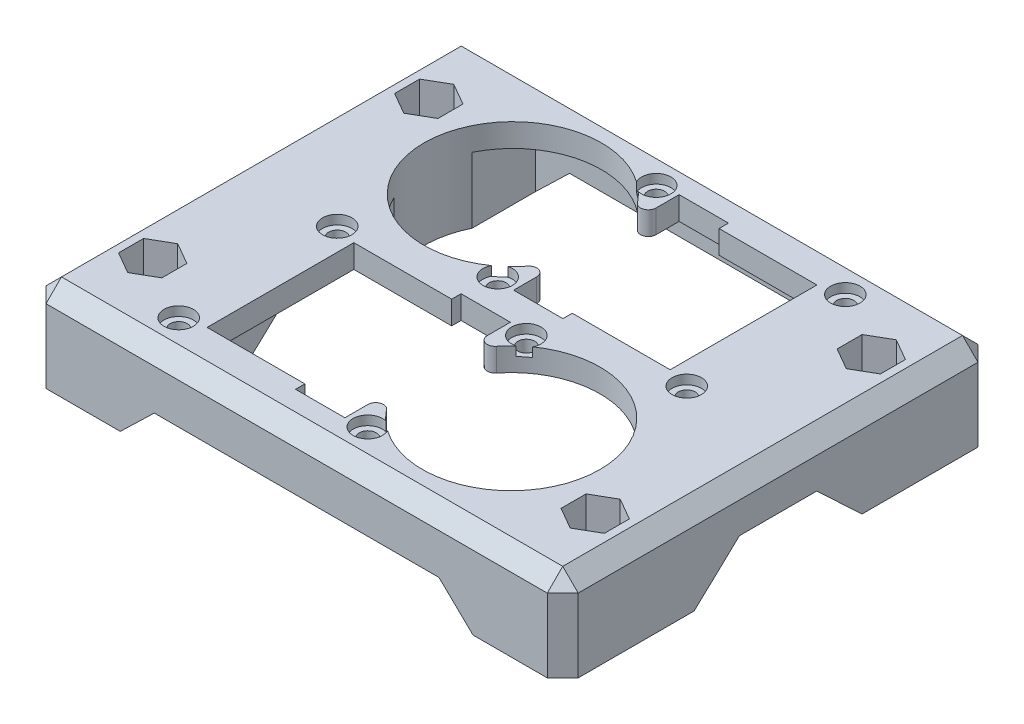
from build123d import *
from build123d.topology import SkipClean

# Parameters (mm, degrees)
ESQUISSE1_W                                        = 50.5
ESQUISSE1_H                                        = 51.7
ESQUISSE1_R                                        = 1.1
BOSS_EXTRU_1_DEPTH                                 = 3
CONG_1_R                                           = 1
CHAMBRAGE_POUR_VIS_SIX_PANS_CREUX_M1_6_D           = 2.2
CHAMBRAGE_POUR_VIS_SIX_PANS_CREUX_M1_6_CBORE_D     = 3.8
CHAMBRAGE_POUR_VIS_SIX_PANS_CREUX_M1_6_CBORE_DEPTH = 1.2
BOSS_EXTRU_2_START                                 = -19
ESQUISSE4_R                                        = 1.6
BOSS_EXTRU_2_DEPTH                                 = 19
ENL_V_START                                        = -19
ENL_V_MAT_EXTRU_1_DEPTH                            = 7
ENL_V_MAT_EXTRU_2_DEPTH                            = 77.075175977
ENL_V_MAT_EXTRU_2_DEPTH_BACK                       = 77.075175977
BOSS_EXTRU_3_DEPTH                                 = 2
CHANFREIN1_SIZE                                    = 2


with BuildPart() as part:
    # Esquisse1 → Boss.-Extru.1 (new body)
    with BuildSketch(Plane(origin=(0, 0, 0), x_dir=(1, 0, 0), z_dir=(0, 1, 0))):
        with Locations((4.2, -2.35)):
            Rectangle(ESQUISSE1_W, ESQUISSE1_H)
        with Locations(Location((-16.05, -25.2, 0), (0, 0, 270))):
            Circle(ESQUISSE1_R, mode=Mode.SUBTRACT)
        with Locations(Location((-16.05, -4.7, 0), (0, 0, 270))):
            Circle(ESQUISSE1_R, mode=Mode.SUBTRACT)
        with Locations(Location((8.4, -25.2, 0), (0, 0, 270))):
            Circle(ESQUISSE1_R, mode=Mode.SUBTRACT)
        with BuildLine():
            Line((-0.49, -5.46), (-0.49, -4.25))
            Line((-0.49, -4.25), (5.89, -4.25))
            Line((5.89, -4.25), (5.89, -11.085507795))
            ThreePointArc((5.89, -11.085507795), (18.661071136, -3.638740123), (28.18, -14.95))
            ThreePointArc((28.18, -14.95), (18.661071136, -26.261259877), (5.89, -18.814492205))
            Line((5.89, -18.814492205), (5.89, -25.65))
            Line((5.89, -25.65), (-0.49, -25.65))
            Line((-0.49, -25.65), (-0.49, -24.44))
            Line((-0.49, -24.44), (-13.14, -24.44))
            Line((-13.14, -24.44), (-13.14, -5.46))
            Line((-13.14, -5.46), (-0.49, -5.46))
        make_face(mode=Mode.SUBTRACT)
        with Locations(Location((8.4, -4.7, 0), (0, 0, 270))):
            Circle(ESQUISSE1_R, mode=Mode.SUBTRACT)
        with Locations(Location((0, 0, 0), (0, 0, 270))):
            Circle(ESQUISSE1_R, mode=Mode.SUBTRACT)
        with BuildLine():
            Line((8.89, 20.95), (8.89, 19.74))
            Line((8.89, 19.74), (21.54, 19.74))
            Line((21.54, 19.74), (21.54, 0.76))
            Line((21.54, 0.76), (8.89, 0.76))
            Line((8.89, 0.76), (8.89, -0.45))
            Line((8.89, -0.45), (2.51, -0.45))
            Line((2.51, -0.45), (2.51, 6.385507795))
            ThreePointArc((2.51, 6.385507795), (-19.78, 10.25), (2.51, 14.114492205))
            Line((2.51, 14.114492205), (2.51, 20.95))
            Line((2.51, 20.95), (8.89, 20.95))
        make_face(mode=Mode.SUBTRACT)
        with Locations(Location((0, 20.5, 0), (0, 0, 270))):
            Circle(ESQUISSE1_R, mode=Mode.SUBTRACT)
        with Locations(Location((24.45, 0, 0), (0, 0, 270))):
            Circle(ESQUISSE1_R, mode=Mode.SUBTRACT)
        with Locations(Location((24.45, 20.5, 0), (0, 0, 270))):
            Circle(ESQUISSE1_R, mode=Mode.SUBTRACT)
    extrude(amount=BOSS_EXTRU_1_DEPTH)

    # Congé1
    cong_1_edges = [part.edges().sort_by_distance(p)[0] for p in [
        (2.51, 1.5, -6.385507795),
        (2.51, 1.5, -14.114492205),
        (5.89, 1.5, 11.085507795),
        (5.89, 1.5, 18.814492205),
    ]]
    fillet(cong_1_edges, radius=CONG_1_R)

    # Chambrage pour vis à six pans creux M1.61 (through all)
    with Locations(Plane(origin=(0, 3, 0), x_dir=(1, 0, 0), z_dir=(0, 1, 0))):
        with Locations((-16.05, -4.7), (-16.05, -25.2), (8.4, -25.2), (8.4, -4.7), (0, 0), (0, 20.5), (24.45, 20.5), (24.45, 0)):
            CounterBoreHole(CHAMBRAGE_POUR_VIS_SIX_PANS_CREUX_M1_6_D / 2, CHAMBRAGE_POUR_VIS_SIX_PANS_CREUX_M1_6_CBORE_D / 2, CHAMBRAGE_POUR_VIS_SIX_PANS_CREUX_M1_6_CBORE_DEPTH)

    # Esquisse4 → Boss.-Extru.2 (add)
    # profile 1 of 2: a face of its own
    with SkipClean():  # the faces are left unmerged after this step: merging them gives an invalid solid
        with BuildSketch(Plane(origin=(0, 3, 0), x_dir=(1, 0, 0), z_dir=(0, 1, 0)).offset(BOSS_EXTRU_2_START)):
            with BuildLine():
                Line((-18.61, 23.5), (-30.21, 23.5))
                Line((-30.21, 23.5), (-30.21, -28.2))
                Line((-30.21, -28.2), (-18.61, -28.2))
                Line((-18.61, -28.2), (-18.61, 5.200811946))
                ThreePointArc((-18.61, 5.200811946), (-19.78, 10.25), (-18.61, 15.299188054))
                Line((-18.61, 15.299188054), (-18.61, 23.5))
            make_face()
            with Locations(Location((-24.41, 15.5, 0), (0, 0, 270))):
                Circle(ESQUISSE4_R, mode=Mode.SUBTRACT)
            with Locations(Location((-24.41, -20.2, 0), (0, 0, 90))):
                Circle(ESQUISSE4_R, mode=Mode.SUBTRACT)
        # profile 2 of 2: a face of its own
        with BuildSketch(Plane(origin=(0, 3, 0), x_dir=(1, 0, 0), z_dir=(0, 1, 0)).offset(BOSS_EXTRU_2_START)):
            with BuildLine():
                Line((27.01, 23.5), (38.61, 23.5))
                Line((38.61, 23.5), (38.61, -28.2))
                Line((38.61, -28.2), (27.01, -28.2))
                Line((27.01, -28.2), (27.01, -19.999188054))
                ThreePointArc((27.01, -19.999188054), (28.18, -14.95), (27.01, -9.900811946))
                Line((27.01, -9.900811946), (27.01, 23.5))
            make_face()
            with Locations(Location((32.81, 15.5, 0), (0, 0, 90))):
                Circle(ESQUISSE4_R, mode=Mode.SUBTRACT)
            with Locations(Location((32.81, -20.2, 0), (0, 0, 270))):
                Circle(ESQUISSE4_R, mode=Mode.SUBTRACT)
        extrude(amount=BOSS_EXTRU_2_DEPTH)

    # Esquisse5 → Enlèv. mat.-Extru.1 (cut)
    with SkipClean():  # the faces are left unmerged after this step: merging them gives an invalid solid
        with BuildSketch(Plane.XZ.offset(16).offset(ENL_V_START)):
            Polygon((-24.41, 23.433161507), (-27.21, 21.816580754), (-27.21, 18.583419246), (-24.41, 16.966838493), (-21.61, 18.583419246), (-21.61, 21.816580754), align=None)
            Polygon((-24.41, -12.266838493), (-27.21, -13.883419246), (-27.21, -17.116580754), (-24.41, -18.733161507), (-21.61, -17.116580754), (-21.61, -13.883419246), align=None)
            Polygon((32.81, -12.266838493), (30.01, -13.883419246), (30.01, -17.116580754), (32.81, -18.733161507), (35.61, -17.116580754), (35.61, -13.883419246), align=None)
            Polygon((32.81, 23.433161507), (30.01, 21.816580754), (30.01, 18.583419246), (32.81, 16.966838493), (35.61, 18.583419246), (35.61, 21.816580754), align=None)
        extrude(amount=ENL_V_MAT_EXTRU_1_DEPTH, mode=Mode.SUBTRACT)

    # Esquisse6 → Enlèv. mat.-Extru.2 (cut, two sides: drawn at the far end of the back side and taken through both)
    with SkipClean():  # the faces are left unmerged after this step: merging them gives an invalid solid
        with BuildSketch(Plane(origin=(38.61, 0, 0), x_dir=(0, 0, -1), z_dir=(1, 0, 0)).offset(-ENL_V_MAT_EXTRU_2_DEPTH_BACK)):
            Polygon((-28.2, -8.5), (-13.2, -8.5), (-7.35, -3), (2.65, -3), (8.5, -8.5), (23.5, -8.5), (23.5, -16), (-28.2, -16), align=None)
        extrude(amount=ENL_V_MAT_EXTRU_2_DEPTH + ENL_V_MAT_EXTRU_2_DEPTH_BACK, mode=Mode.SUBTRACT)

    # Esquisse7 → Boss.-Extru.3 (add)
    with SkipClean():  # the faces are left unmerged after this step: merging them gives an invalid solid
        with BuildSketch(Plane.XY.offset(28.2)):
            Polygon((-18.61, -8.5), (-14.205, -4.25), (22.605, -4.25), (27.01, -8.5), (38.61, -8.5), (38.61, 3), (-30.21, 3), (-30.21, -8.5), align=None)
        boss_extru_3 = extrude(amount=BOSS_EXTRU_3_DEPTH)

    # Symétrie1: Boss.-Extru.3 across plane
    with SkipClean():  # the faces are left unmerged after this step: merging them gives an invalid solid
        add(boss_extru_3.mirror(Plane.XY.offset(2.35)))

    # Chanfrein1
    chanfrein1_edges = [part.edges().sort_by_distance(p)[0] for p in [
        (-30.21, 3, 2.35),
        (38.61, 3, 2.35),
        (38.61, -2.75, 30.2),
        (4.2, 3, 30.2),
        (-30.21, -2.75, 30.2),
        (-30.21, -2.75, -25.5),
        (4.2, 3, -25.5),
        (38.61, -2.75, -25.5),
    ]]
    chamfer(chanfrein1_edges, length=CHANFREIN1_SIZE - 0.0001)  # a hair under: the kernel refuses the full size


solid = part.part
